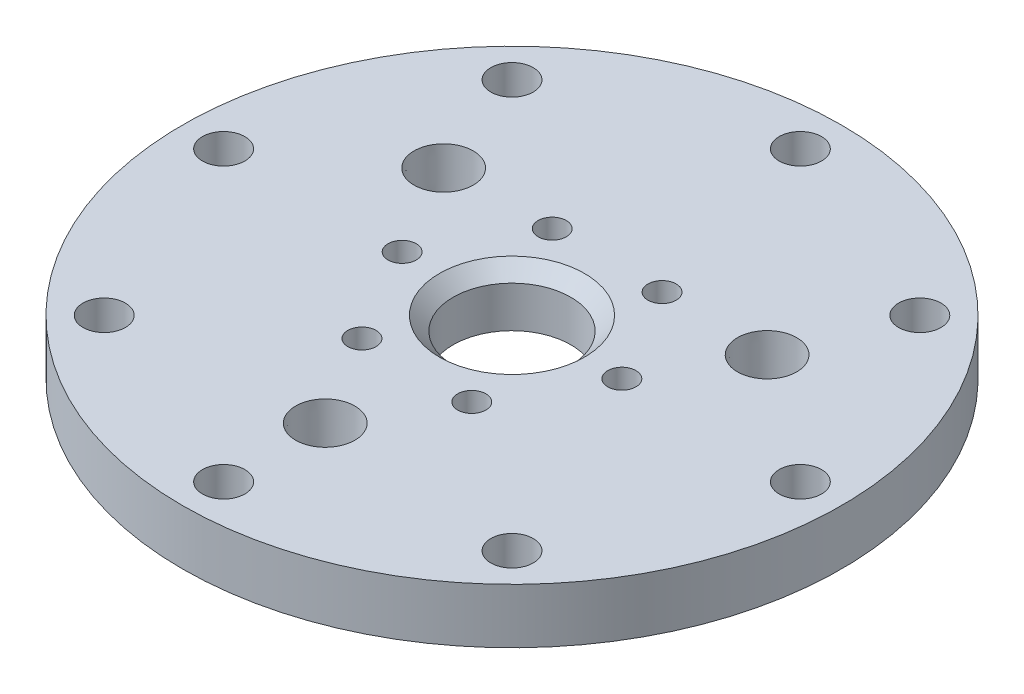
from build123d import *

# Parameters (mm, degrees)
SKETCH1_R                         = 76.2
BOSS_EXTRUDE1_DEPTH               = 12.7
F_3_8_CLEARANCE_HOLE1_D           = 9.8044
F_1_4_CLEARANCE_HOLE1_D           = 6.5278
F_1_4_NPT_TAPPED_HOLE1_AT_2_COUNT = 2
F_1_4_NPT_TAPPED_HOLE1_AT_2_PITCH = 74.789953871
F_1_4_NPT_TAPPED_HOLE1_AT_3_COUNT = 2
F_1_4_NPT_TAPPED_HOLE1_AT_3_PITCH = 74.789953871
SKETCH8_R                         = 13.6
CUT_EXTRUDE1_DEPTH                = 109.508847566
CHAMFER1_SIZE                     = 3.175


with BuildPart() as part:
    # Sketch1 → Boss-Extrude1 (new body)
    with BuildSketch(Plane(origin=(0, 0, 0), x_dir=(1, 0, 0), z_dir=(0, 1, 0))):
        Circle(SKETCH1_R)
    extrude(amount=BOSS_EXTRUDE1_DEPTH)

    # 3/8 Clearance Hole1 (through all)
    with Locations(Plane(origin=(0, 12.7, 0), x_dir=(1, 0, 0), z_dir=(0, 1, 0))):
        with Locations((47.146344636, -47.146344636), (66.675, 0), (47.146344636, 47.146344636), (0, 66.675), (-47.146344636, 47.146344636), (-66.675, 0), (-47.146344636, -47.146344636), (0, -66.675)):
            Hole(F_3_8_CLEARANCE_HOLE1_D / 2)

    # 1/4 Clearance Hole1 (through all)
    with Locations(Plane(origin=(0, 12.7, 0), x_dir=(1, 0, 0), z_dir=(0, 1, 0))):
        with Locations((12.7, -21.997045256), (25.4, 0), (12.7, 21.997045256), (-12.7, 21.997045256), (-25.4, 0), (-12.7, -21.997045256)):
            Hole(F_1_4_CLEARANCE_HOLE1_D / 2)

    # Sketch7 → 1/4 NPT Tapped Hole1 (revolve, cut)
    with BuildSketch(Plane(origin=(-37.394976935, 12.7, -21.59), x_dir=(0, 0, 1), z_dir=(1, 0, 0))):
        Polygon((0, 0), (0, 12.7), (5.5626, 12.7), (5.5626, 9.906), (6.557984794, 9.906), (6.8545837, 0), align=None)
    f_1_4_npt_tapped_hole1 = revolve(axis=Axis((-37.394976935, 19.05, -21.59), (0, -1, 0)), mode=Mode.SUBTRACT)

    # 1/4 NPT Tapped Hole1 at 2: 1/4 NPT Tapped Hole1 ×2
    with Locations(*[Vector(0.5000000000000003, 0, 0.8660254037844386) * (i * F_1_4_NPT_TAPPED_HOLE1_AT_2_PITCH) for i in range(1, F_1_4_NPT_TAPPED_HOLE1_AT_2_COUNT)]):
        add(f_1_4_npt_tapped_hole1, mode=Mode.SUBTRACT)

    # 1/4 NPT Tapped Hole1 at 3: 1/4 NPT Tapped Hole1 ×2
    with Locations(*[(i * F_1_4_NPT_TAPPED_HOLE1_AT_3_PITCH, 0, 0) for i in range(1, F_1_4_NPT_TAPPED_HOLE1_AT_3_COUNT)]):
        add(f_1_4_npt_tapped_hole1, mode=Mode.SUBTRACT)

    # Sketch8 → Cut-Extrude1 (cut, through all)
    with BuildSketch(Plane(origin=(0, 12.7, 0), x_dir=(1, 0, 0), z_dir=(0, 1, 0))):
        Circle(SKETCH8_R)
    extrude(amount=-CUT_EXTRUDE1_DEPTH, mode=Mode.SUBTRACT)

    # Chamfer1
    chamfer1_edges = [part.edges().sort_by_distance(p)[0] for p in [
        (-13.6, 12.7, 0),
    ]]
    chamfer(chamfer1_edges, length=CHAMFER1_SIZE)


solid = part.part
